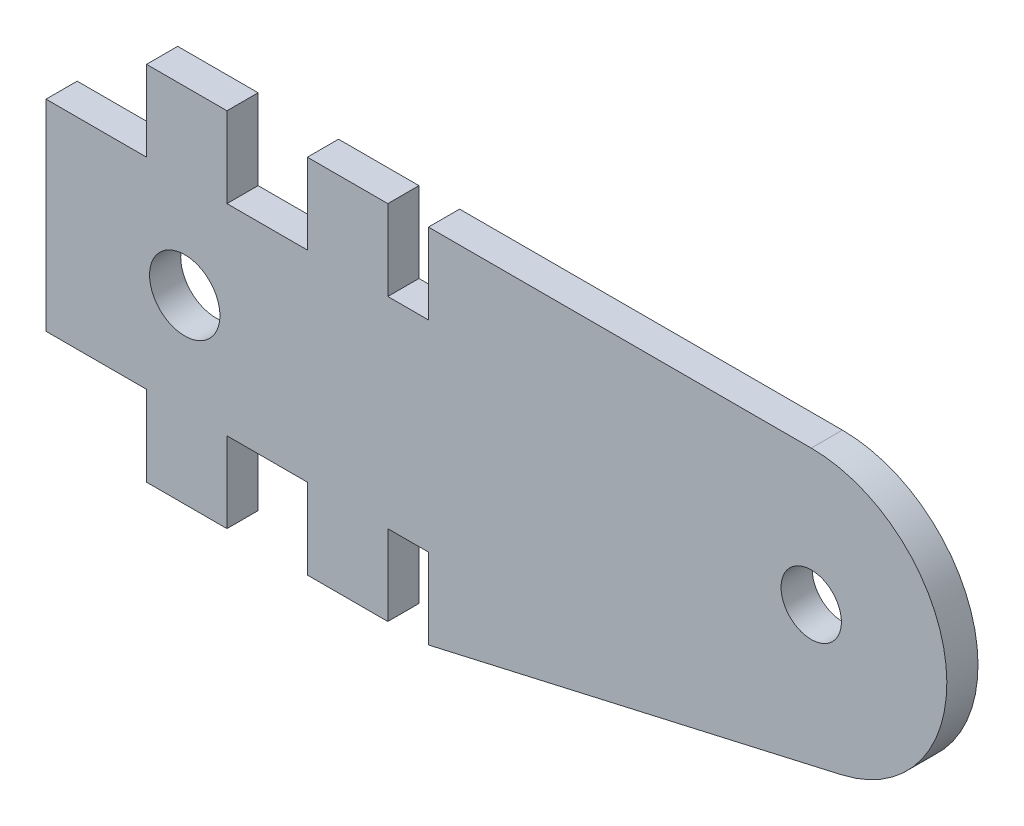
from build123d import *

# Parameters (mm, degrees)
SKETCH1_R           = 1.75
SKETCH1_R_2         = 1.5
BOSS_EXTRUDE1_DEPTH = 1.55


with BuildPart() as part:
    # Sketch1 → Boss-Extrude1 (new body)
    with BuildSketch(Plane.XY):
        with BuildLine():
            Line((5, 0), (9, 0))
            Line((9, 0), (9, 4))
            Line((9, 4), (13, 4))
            Line((13, 4), (13, 0))
            Line((13, 0), (17, 0))
            Line((17, 0), (17, 4))
            Line((17, 4), (19.021561934, 4))
            Line((19.021561934, 4), (19.021561934, 0))
            Line((19.021561934, 0), (39.557599026, 4.677766061))
            ThreePointArc((39.557599026, 4.677766061), (44.762590659, 12.008417985), (38.059495851, 17.999988357))
            Line((38.059495851, 17.999988357), (19.021561934, 17.999988357))
            Line((19.021561934, 17.999988357), (19.021561934, 13.999988357))
            Line((19.021561934, 13.999988357), (17, 13.999988357))
            Line((17, 13.999988357), (17, 17.999988357))
            Line((17, 17.999988357), (13, 17.999988357))
            Line((13, 17.999988357), (13, 13.999988357))
            Line((13, 13.999988357), (9, 13.999988357))
            Line((9, 13.999988357), (9, 17.999988357))
            Line((9, 17.999988357), (5, 17.999988357))
            Line((5, 17.999988357), (5, 13.999988357))
            Line((5, 13.999988357), (0, 13.999988357))
            Line((0, 13.999988357), (0, 4))
            Line((0, 4), (5, 4))
            Line((5, 4), (5, 0))
        make_face()
        with Locations((6.9, 9)):
            Circle(SKETCH1_R, mode=Mode.SUBTRACT)
        with Locations((38.059495851, 11.254645274)):
            Circle(SKETCH1_R_2, mode=Mode.SUBTRACT)
    extrude(amount=BOSS_EXTRUDE1_DEPTH)


solid = part.part
